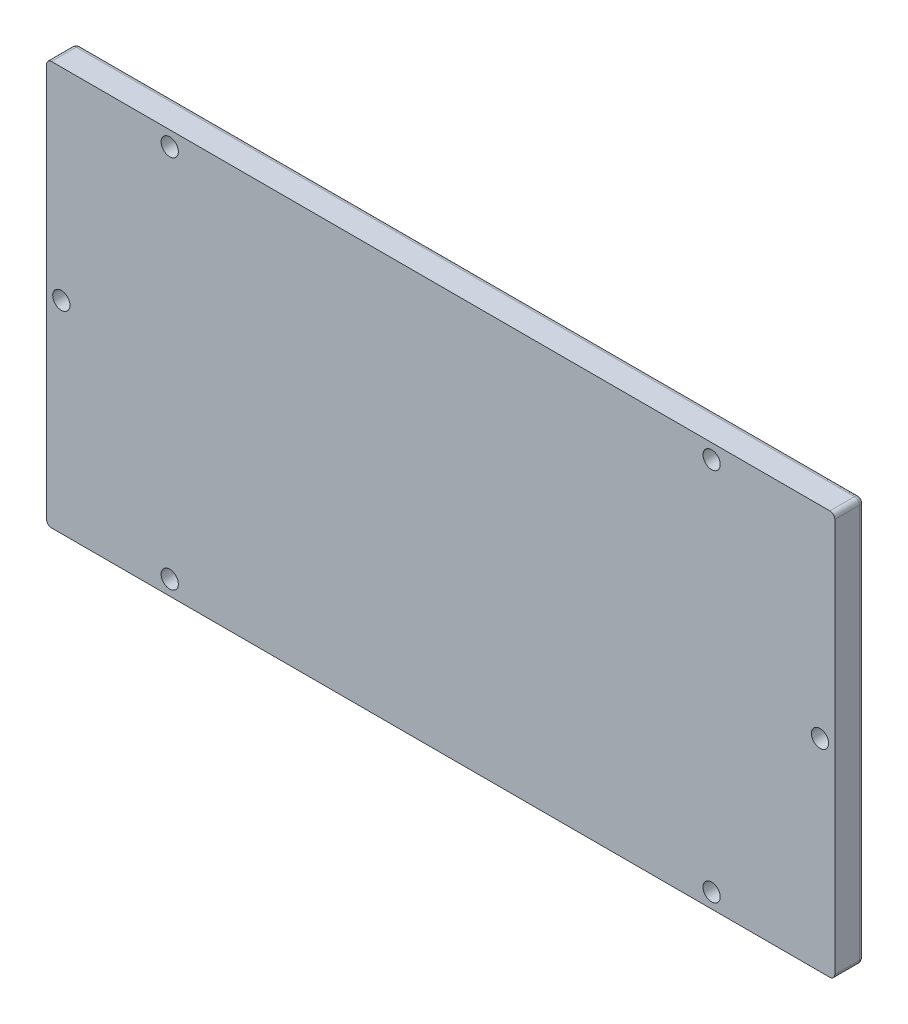
from build123d import *

# Parameters (mm, degrees)
ESQUISSE1_W             = 160
ESQUISSE1_H             = 82
BOSS_EXTRU_1_DEPTH      = 6
ESQUISSE2_R             = 1.75
ENL_V_MAT_EXTRU_1_DEPTH = 6
ESQUISSE3_R             = 1.75
ENL_V_MAT_EXTRU_2_DEPTH = 6
CONG_2_R                = 1


with BuildPart() as part:
    # Esquisse1 → Boss.-Extru.1 (new body)
    with BuildSketch(Plane.XY):
        Rectangle(ESQUISSE1_W, ESQUISSE1_H)
    extrude(amount=BOSS_EXTRU_1_DEPTH)

    # Esquisse2 → Enlèv. mat.-Extru.1 (cut)
    with BuildSketch(Plane.XY):
        with Locations(Location((-55, -38, 0), (0, 0, 180))):
            Circle(ESQUISSE2_R)
        with Locations(Location((55, -38, 0), (0, 0, 180))):
            Circle(ESQUISSE2_R)
        with Locations(Location((-55, 38, 0), (0, 0, 180))):
            Circle(ESQUISSE2_R)
        with Locations(Location((55, 38, 0), (0, 0, 180))):
            Circle(ESQUISSE2_R)
    extrude(amount=ENL_V_MAT_EXTRU_1_DEPTH, mode=Mode.SUBTRACT)

    # Esquisse3 → Enlèv. mat.-Extru.2 (cut)
    with BuildSketch(Plane.XY):
        with Locations(Location((77, 0, 0), (0, 0, 180))):
            Circle(ESQUISSE3_R)
    enl_v_mat_extru_2 = extrude(amount=ENL_V_MAT_EXTRU_2_DEPTH, mode=Mode.SUBTRACT)

    # Symétrie1: Enlèv. mat.-Extru.2 across plane
    add(enl_v_mat_extru_2.mirror(Plane(origin=(0, 0, 0), x_dir=(0, 0, 1), z_dir=(1, 0, 0))), mode=Mode.SUBTRACT)

    # Congé2
    # the kernel refuses this fillet: 1 mm, written as the material it takes off along each edge
    with BuildSketch(Plane(origin=(-79, -40, 1), x_dir=(-1, 0, 0), z_dir=(0, -1, 0))) as cong_2_piece_1_section:
        Polygon((0, 0), (CONG_2_R, 0), (CONG_2_R, CONG_2_R), (0, CONG_2_R), align=None)
    cong_2_piece_1 = extrude(amount=CONG_2_R, mode=Mode.PRIVATE)
    cong_2_piece_1 = cong_2_piece_1 - Plane(origin=(-79, -40, 1), x_dir=(0.7071067811865475, 0, 0.7071067811865475), z_dir=(0, -1, 0)) * Sphere(CONG_2_R, mode=Mode.PRIVATE)
    add(cong_2_piece_1, mode=Mode.SUBTRACT)
    with BuildSketch(Plane(origin=(79, -40, 1), x_dir=(1, 0, 0), z_dir=(0, -1, 0))) as cong_2_piece_2_section:
        Polygon((0, 0), (CONG_2_R, 0), (CONG_2_R, -CONG_2_R), (0, -CONG_2_R), align=None)
    cong_2_piece_2 = extrude(amount=CONG_2_R, mode=Mode.PRIVATE)
    cong_2_piece_2 = cong_2_piece_2 - Plane(origin=(79, -40, 1), x_dir=(-0.7071067811865475, 0, 0.7071067811865475), z_dir=(0, -1, 0)) * Sphere(CONG_2_R, mode=Mode.PRIVATE)
    add(cong_2_piece_2, mode=Mode.SUBTRACT)
    with BuildSketch(Plane(origin=(-79, 40, 1), x_dir=(0, 0, -1), z_dir=(-1, 0, 0))) as cong_2_piece_3_section:
        Polygon((0, 0), (CONG_2_R, 0), (CONG_2_R, -CONG_2_R), (0, -CONG_2_R), align=None)
    cong_2_piece_3 = extrude(amount=CONG_2_R, mode=Mode.PRIVATE)
    cong_2_piece_3 = cong_2_piece_3 - Plane(origin=(-79, 40, 1), x_dir=(0, -0.7071067811865475, 0.7071067811865475), z_dir=(-1, 0, 0)) * Sphere(CONG_2_R, mode=Mode.PRIVATE)
    add(cong_2_piece_3, mode=Mode.SUBTRACT)
    with BuildSketch(Plane(origin=(79, 40, 1), x_dir=(0, 0, -1), z_dir=(1, 0, 0))) as cong_2_piece_4_section:
        Polygon((0, 0), (CONG_2_R, 0), (CONG_2_R, CONG_2_R), (0, CONG_2_R), align=None)
    cong_2_piece_4 = extrude(amount=CONG_2_R, mode=Mode.PRIVATE)
    cong_2_piece_4 = cong_2_piece_4 - Plane(origin=(79, 40, 1), x_dir=(0, -0.7071067811865475, 0.7071067811865475), z_dir=(1, 0, 0)) * Sphere(CONG_2_R, mode=Mode.PRIVATE)
    add(cong_2_piece_4, mode=Mode.SUBTRACT)
    with BuildSketch(Plane(origin=(55, -38, 0), x_dir=(-1, 0, 0), z_dir=(0, 1, 0))) as cong_2_piece_5:
        with BuildLine():
            CenterArc((1.75 + CONG_2_R, CONG_2_R), CONG_2_R, 180, 90)
            Line((1.75, CONG_2_R), (1.75, 0))
            Line((1.75, 0), (1.75 + CONG_2_R, 0))
        make_face()
    revolve(axis=Axis((55, -38, 0), (0, 0, 1)), mode=Mode.SUBTRACT)
    with BuildSketch(Plane(origin=(-55, 38, 0), x_dir=(-1, 0, 0), z_dir=(0, 1, 0))) as cong_2_piece_6:
        with BuildLine():
            CenterArc((1.75 + CONG_2_R, CONG_2_R), CONG_2_R, 180, 90)
            Line((1.75, CONG_2_R), (1.75, 0))
            Line((1.75, 0), (1.75 + CONG_2_R, 0))
        make_face()
    revolve(axis=Axis((-55, 38, 0), (0, 0, 1)), mode=Mode.SUBTRACT)
    with BuildSketch(Plane(origin=(55, 38, 0), x_dir=(-1, 0, 0), z_dir=(0, 1, 0))) as cong_2_piece_7:
        with BuildLine():
            CenterArc((1.75 + CONG_2_R, CONG_2_R), CONG_2_R, 180, 90)
            Line((1.75, CONG_2_R), (1.75, 0))
            Line((1.75, 0), (1.75 + CONG_2_R, 0))
        make_face()
    revolve(axis=Axis((55, 38, 0), (0, 0, 1)), mode=Mode.SUBTRACT)
    with BuildSketch(Plane(origin=(-55, -38, 0), x_dir=(-1, 0, 0), z_dir=(0, 1, 0))) as cong_2_piece_8:
        with BuildLine():
            CenterArc((1.75 + CONG_2_R, CONG_2_R), CONG_2_R, 180, 90)
            Line((1.75, CONG_2_R), (1.75, 0))
            Line((1.75, 0), (1.75 + CONG_2_R, 0))
        make_face()
    revolve(axis=Axis((-55, -38, 0), (0, 0, 1)), mode=Mode.SUBTRACT)
    with BuildSketch(Plane(origin=(77, 0, 0), x_dir=(-1, 0, 0), z_dir=(0, 1, 0))) as cong_2_piece_9:
        with BuildLine():
            CenterArc((1.75 + CONG_2_R, CONG_2_R), CONG_2_R, 180, 90)
            Line((1.75, CONG_2_R), (1.75, 0))
            Line((1.75, 0), (1.75 + CONG_2_R, 0))
        make_face()
    revolve(axis=Axis((77, 0, 0), (0, 0, 1)), mode=Mode.SUBTRACT)
    with BuildSketch(Plane(origin=(-77, 0, 0), x_dir=(1, 0, 0), z_dir=(0, 1, 0))) as cong_2_piece_10:
        with BuildLine():
            CenterArc((1.75 + CONG_2_R, -CONG_2_R), CONG_2_R, 90, 90)
            Line((1.75, -CONG_2_R), (1.75, 0))
            Line((1.75, 0), (1.75 + CONG_2_R, 0))
        make_face()
    revolve(axis=Axis((-77, 0, 0), (0, 0, -1)), mode=Mode.SUBTRACT)
    with BuildSketch(Plane(origin=(-79, -41, 0), x_dir=(0, 0, 1), z_dir=(1, 0, 0))) as cong_2_piece_11:
        with BuildLine():
            CenterArc((CONG_2_R, -CONG_2_R), CONG_2_R, 90, 90)
            Line((0, -CONG_2_R), (0, 0))
            Line((0, 0), (CONG_2_R, 0))
        make_face()
    extrude(amount=158, mode=Mode.SUBTRACT)
    with BuildSketch(Plane(origin=(-80, 40, 0), x_dir=(0, 0, 1), z_dir=(0, -1, 0)), Plane(origin=(80, -40, 0), x_dir=(0, 0, 1), z_dir=(0, 1, 0))) as cong_2_piece_12:
        with BuildLine():
            CenterArc((CONG_2_R, -CONG_2_R), CONG_2_R, 90, 90)
            Line((0, -CONG_2_R), (0, 0))
            Line((0, 0), (CONG_2_R, 0))
        make_face()
    extrude(amount=80, mode=Mode.SUBTRACT)
    with BuildSketch(Plane(origin=(79, 41, 0), x_dir=(0, -1, 0), z_dir=(-1, 0, 0))) as cong_2_piece_13:
        with BuildLine():
            CenterArc((CONG_2_R, CONG_2_R), CONG_2_R, 180, 90)
            Line((0, CONG_2_R), (0, 0))
            Line((0, 0), (CONG_2_R, 0))
        make_face()
    extrude(amount=158, mode=Mode.SUBTRACT)
    with BuildSketch(Plane(origin=(80, -41, 1), x_dir=(-1, 0, 0), z_dir=(0, 0, 1)), Plane(origin=(80, 41, 1), x_dir=(0, -1, 0), z_dir=(0, 0, 1))) as cong_2_piece_14:
        with BuildLine():
            CenterArc((CONG_2_R, -CONG_2_R), CONG_2_R, 90, 90)
            Line((0, -CONG_2_R), (0, 0))
            Line((0, 0), (CONG_2_R, 0))
        make_face()
    extrude(amount=7.5, mode=Mode.SUBTRACT)
    with BuildSketch(Plane(origin=(-80, -41, 1), x_dir=(1, 0, 0), z_dir=(0, 0, 1)), Plane(origin=(-80, 41, 1), x_dir=(0, -1, 0), z_dir=(0, 0, 1))) as cong_2_piece_15:
        with BuildLine():
            CenterArc((CONG_2_R, CONG_2_R), CONG_2_R, 180, 90)
            Line((0, CONG_2_R), (0, 0))
            Line((0, 0), (CONG_2_R, 0))
        make_face()
    extrude(amount=7.5, mode=Mode.SUBTRACT)


solid = part.part
